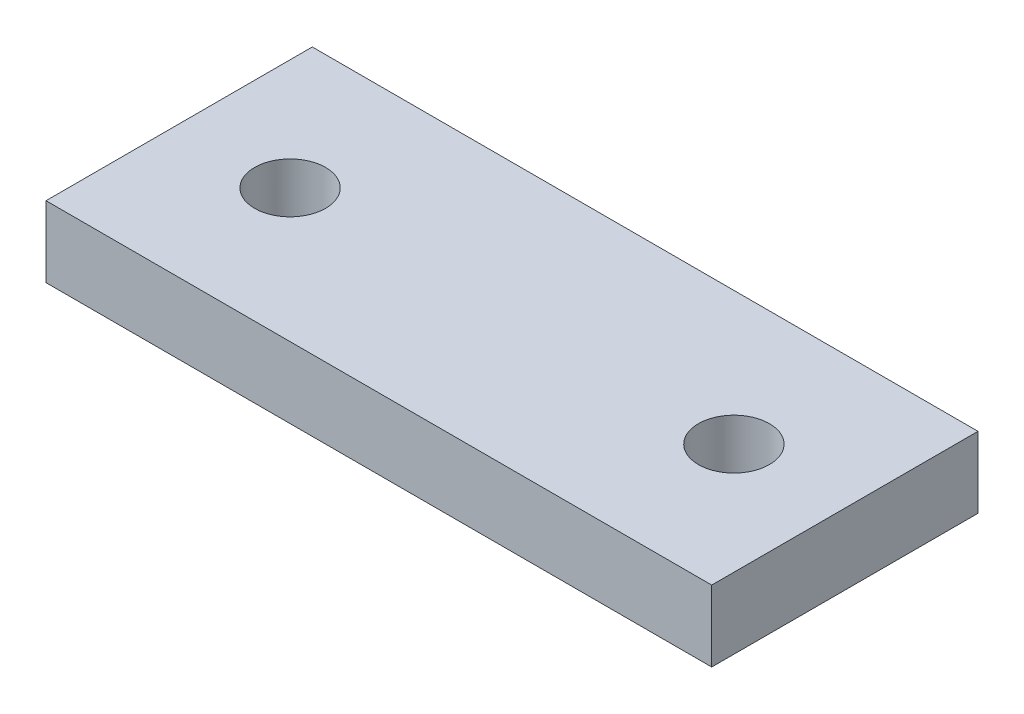
from build123d import *

# Parameters (mm, degrees)
SKETCH1_W               = 75
SKETCH1_H               = 8
BOSS_EXTRUDE1_DEPTH     = 30
CUT_EXTRUDE1_DEPTH      = 49.685213361
CUT_EXTRUDE1_DEPTH_BACK = 49.685213361
SKETCH2_R               = 4


with BuildPart() as part:
    # Sketch1 → Boss-Extrude1 (new body)
    with BuildSketch(Plane.XY):
        with Locations((0, -4)):
            Rectangle(SKETCH1_W, SKETCH1_H)
    extrude(amount=BOSS_EXTRUDE1_DEPTH)

    # Sketch2 → Cut-Extrude1 (cut, two sides: drawn at the far end of the back side and taken through both)
    with BuildSketch(Plane(origin=(0, 0, 0), x_dir=(1, 0, 0), z_dir=(0, 1, 0)).offset(-CUT_EXTRUDE1_DEPTH_BACK)):
        with Locations((-25, -15)):
            Circle(SKETCH2_R)
        with Locations((25, -15)):
            Circle(SKETCH2_R)
    extrude(amount=CUT_EXTRUDE1_DEPTH + CUT_EXTRUDE1_DEPTH_BACK, mode=Mode.SUBTRACT)


solid = part.part
